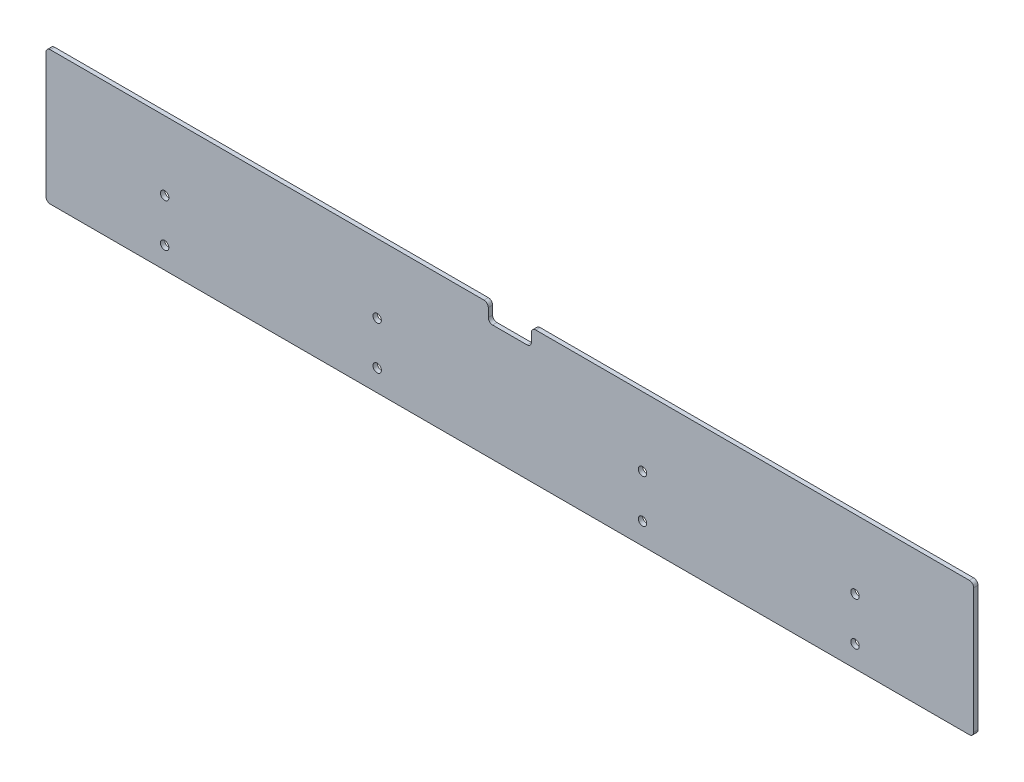
from build123d import *

# Parameters (mm, degrees)
SKETCH1_R           = 1.95
BOSS_EXTRUDE1_DEPTH = 2
FILLET1_R           = 2
SKETCH2_R           = 1.95
CUT_EXTRUDE1_DEPTH  = 10


with BuildPart() as part:
    # Sketch1 → Boss-Extrude1 (new body)
    with BuildSketch(Plane.XY):
        Polygon((-131.905896291, 17.703517588), (73.094103709, 17.703517588), (73.094103709, -44.296482412), (-356.905896291, -44.296482412), (-356.905896291, 17.703517588), (-151.905896291, 17.703517588), (-151.905896291, 9.703517588), (-131.905896291, 9.703517588), align=None)
        with Locations((-80.405896291, -14.296482412)):
            Circle(SKETCH1_R, mode=Mode.SUBTRACT)
        with Locations((-80.405896291, -34.296482412)):
            Circle(SKETCH1_R, mode=Mode.SUBTRACT)
        with Locations((-203.405896291, -14.296482412)):
            Circle(SKETCH1_R, mode=Mode.SUBTRACT)
        with Locations((-203.405896291, -34.296482412)):
            Circle(SKETCH1_R, mode=Mode.SUBTRACT)
    extrude(amount=BOSS_EXTRUDE1_DEPTH)

    # Fillet1
    fillet1_edges = [part.edges().sort_by_distance(p)[0] for p in [
        (73.094103709, -44.296482412, 1),
        (-356.905896291, -44.296482412, 1),
        (-356.905896291, 17.703517588, 1),
        (-151.905896291, 9.703517588, 1),
        (-151.905896291, 17.703517588, 1),
        (-131.905896291, 9.703517588, 1),
        (-131.905896291, 17.703517588, 1),
        (73.094103709, 17.703517588, 1),
    ]]
    fillet(fillet1_edges, radius=FILLET1_R)

    # Sketch2 → Cut-Extrude1 (cut)
    with BuildSketch(Plane.XY.offset(2)):
        with Locations((-301.905896291, -14.296482412)):
            Circle(SKETCH2_R)
        with Locations((-301.905896291, -34.296482412)):
            Circle(SKETCH2_R)
        with Locations((18.094103709, -14.296482412)):
            Circle(SKETCH2_R)
        with Locations((18.094103709, -34.296482412)):
            Circle(SKETCH2_R)
    extrude(amount=-CUT_EXTRUDE1_DEPTH, mode=Mode.SUBTRACT)


solid = part.part
